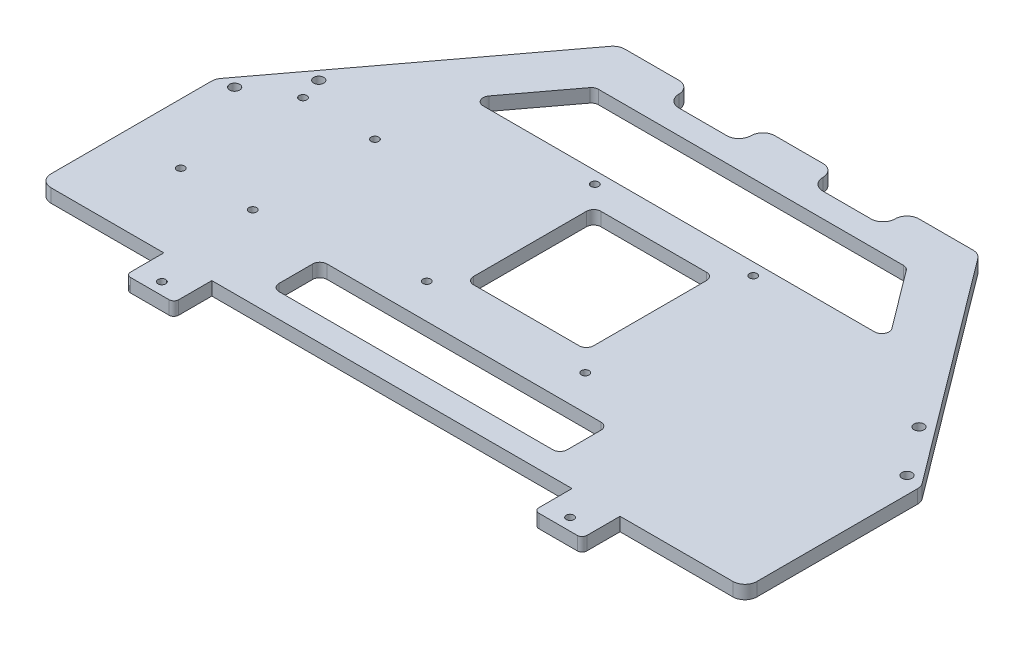
from build123d import *

# Parameters (mm, degrees)
SKETCH_1_R          = 2.1
EXTRUDE_1_DEPTH     = 5.6
SKETCH_2_W          = 20
SKETCH_2_H          = 15.8
SKETCH_2_R          = 1.6
EXTRUDE_2_DEPTH     = 5.6
SKETCH_3_R          = 1.6
CUT_EXTRUDE_1_DEPTH = 199.148738326
SKETCH_4_W          = 50
SKETCH_4_H          = 53.03030303
SKETCH_4_W_2        = 120
SKETCH_4_H_2        = 20
CUT_EXTRUDE_2_DEPTH = 199.148738326
SKETCH_6_W          = 90
SKETCH_6_H          = 10
CUT_EXTRUDE_3_DEPTH = 199.148738326
SKETCH_7_W          = 30
SKETCH_7_H          = 10
EXTRUDE_3_DEPTH     = 5.6
FILLET_1_R          = 3
FILLET_2_R          = 5
FILLET_3_R          = 2


with BuildPart() as part:
    # ｽｹｯﾁ1 → ﾎﾞｽ - 押し出し1 (new body)
    with BuildSketch(Plane(origin=(0, 0, 0), x_dir=(1, 0, 0), z_dir=(0, 1, 0))):
        Polygon((-147, 36.75), (-147, -36.75), (147, -36.75), (147, 36.75), (75, 132.75), (-75, 132.75), align=None)
        with Locations(Location((140, 37.75, 0), (0, 0, 270))):
            Circle(SKETCH_1_R, mode=Mode.SUBTRACT)
        with Locations(Location((-140, 37.75, 0), (0, 0, 270))):
            Circle(SKETCH_1_R, mode=Mode.SUBTRACT)
        with Locations(Location((125, 57.75, 0), (0, 0, 270))):
            Circle(SKETCH_1_R, mode=Mode.SUBTRACT)
        with Locations(Location((-125, 57.75, 0), (0, 0, 270))):
            Circle(SKETCH_1_R, mode=Mode.SUBTRACT)
    extrude(amount=EXTRUDE_1_DEPTH)

    # ｽｹｯﾁ2 → ﾎﾞｽ - 押し出し2 (add)
    # profile 1 of 2: a face of its own
    with BuildSketch(Plane(origin=(0, 0, 0), x_dir=(1, 0, 0), z_dir=(0, 1, 0))):
        with Locations((-85, -44.65)):
            Rectangle(SKETCH_2_W, SKETCH_2_H)
        with Locations(Location((-85, -47.55, 0), (0, 0, 270))):
            Circle(SKETCH_2_R, mode=Mode.SUBTRACT)
    # profile 2 of 2: a face of its own
    with BuildSketch(Plane(origin=(0, 0, 0), x_dir=(1, 0, 0), z_dir=(0, 1, 0))):
        with Locations((85, -44.65)):
            Rectangle(SKETCH_2_W, SKETCH_2_H)
        with Locations(Location((85, -47.55, 0), (0, 0, 90))):
            Circle(SKETCH_2_R, mode=Mode.SUBTRACT)
    extrude(amount=EXTRUDE_2_DEPTH)

    # ｽｹｯﾁ3 → ｶｯﾄ - 押し出し1 (cut, through all)
    with BuildSketch(Plane(origin=(0, 5.6, 0), x_dir=(1, 0, 0), z_dir=(0, 1, 0))):
        with Locations(Location((36, 77.75, 0), (0, 0, 270))):
            Circle(SKETCH_3_R)
        with Locations(Location((-30, 77.75, 0), (0, 0, 90))):
            Circle(SKETCH_3_R)
        with Locations(Location((-30, 7.75, 0), (0, 0, 270))):
            Circle(SKETCH_3_R)
        with Locations(Location((36, 7.75, 0), (0, 0, 90))):
            Circle(SKETCH_3_R)
        with Locations(Location((-92.005, 48.19, 0), (0, 0, 270))):
            Circle(SKETCH_3_R)
        with Locations(Location((-92.005, -2.69, 0), (0, 0, 90))):
            Circle(SKETCH_3_R)
        with Locations(Location((-121.995, -2.69, 0), (0, 0, 270))):
            Circle(SKETCH_3_R)
        with Locations(Location((-121.995, 48.19, 0), (0, 0, 90))):
            Circle(SKETCH_3_R)
    extrude(amount=-CUT_EXTRUDE_1_DEPTH, mode=Mode.SUBTRACT)

    # ｽｹｯﾁ4 → ｶｯﾄ - 押し出し2 (cut, through all)
    with BuildSketch(Plane(origin=(0, 5.6, 0), x_dir=(1, 0, 0), z_dir=(0, 1, 0))):
        Polygon((-87.5, 82.75), (87.5, 82.75), (65, 112.75), (-65, 112.75), align=None)
        with Locations((3, 42.75)):
            Rectangle(SKETCH_4_W, SKETCH_4_H)
        with Locations((0, -16.75)):
            Rectangle(SKETCH_4_W_2, SKETCH_4_H_2)
    extrude(amount=-CUT_EXTRUDE_2_DEPTH, mode=Mode.SUBTRACT)

    # ｽｹｯﾁ6 → ｶｯﾄ - 押し出し3 (cut, through all)
    with BuildSketch(Plane(origin=(0, 5.6, 0), x_dir=(1, 0, 0), z_dir=(0, 1, 0))):
        with Locations((0, 127.75)):
            Rectangle(SKETCH_6_W, SKETCH_6_H)
    extrude(amount=-CUT_EXTRUDE_3_DEPTH, mode=Mode.SUBTRACT)

    # ｽｹｯﾁ7 → ﾎﾞｽ - 押し出し3 (add)
    with BuildSketch(Plane(origin=(0, 5.6, 0), x_dir=(1, 0, 0), z_dir=(0, 1, 0))):
        with Locations((0, 127.75)):
            Rectangle(SKETCH_7_W, SKETCH_7_H)
    extrude(amount=-EXTRUDE_3_DEPTH)

    # ﾌｨﾚｯﾄ1
    fillet_1_edges = [part.edges().sort_by_distance(p)[0] for p in [
        (-87.5, 2.8, -82.75),
        (-65, 2.8, -112.75),
        (65, 2.8, -112.75),
        (87.5, 2.8, -82.75),
        (28, 2.8, -69.265151515),
        (28, 2.8, -16.234848485),
        (-22, 2.8, -16.234848485),
        (-22, 2.8, -69.265151515),
        (60, 2.8, 26.75),
        (-60, 2.8, 26.75),
        (-60, 2.8, 6.75),
        (60, 2.8, 6.75),
    ]]
    fillet(fillet_1_edges, radius=FILLET_1_R)

    # ﾌｨﾚｯﾄ2
    fillet_2_edges = [part.edges().sort_by_distance(p)[0] for p in [
        (-147, 2.8, 36.75),
        (-147, 2.8, -36.75),
        (-75, 2.8, -132.75),
        (75, 2.8, -132.75),
        (147, 2.8, -36.75),
        (147, 2.8, 36.75),
        (45, 2.8, -132.75),
        (45, 2.8, -122.75),
        (-45, 2.8, -132.75),
        (-45, 2.8, -122.75),
        (15, 2.8, -132.75),
        (15, 2.8, -122.75),
        (-15, 2.8, -132.75),
        (-15, 2.8, -122.75),
    ]]
    fillet(fillet_2_edges, radius=FILLET_2_R - 0.0001)  # a hair under: the kernel refuses the full size

    # ﾌｨﾚｯﾄ3
    fillet_3_edges = [part.edges().sort_by_distance(p)[0] for p in [
        (-95, 2.8, 52.55),
        (-75, 2.8, 52.55),
        (75, 2.8, 52.55),
        (95, 2.8, 52.55),
    ]]
    fillet(fillet_3_edges, radius=FILLET_3_R)


solid = part.part
